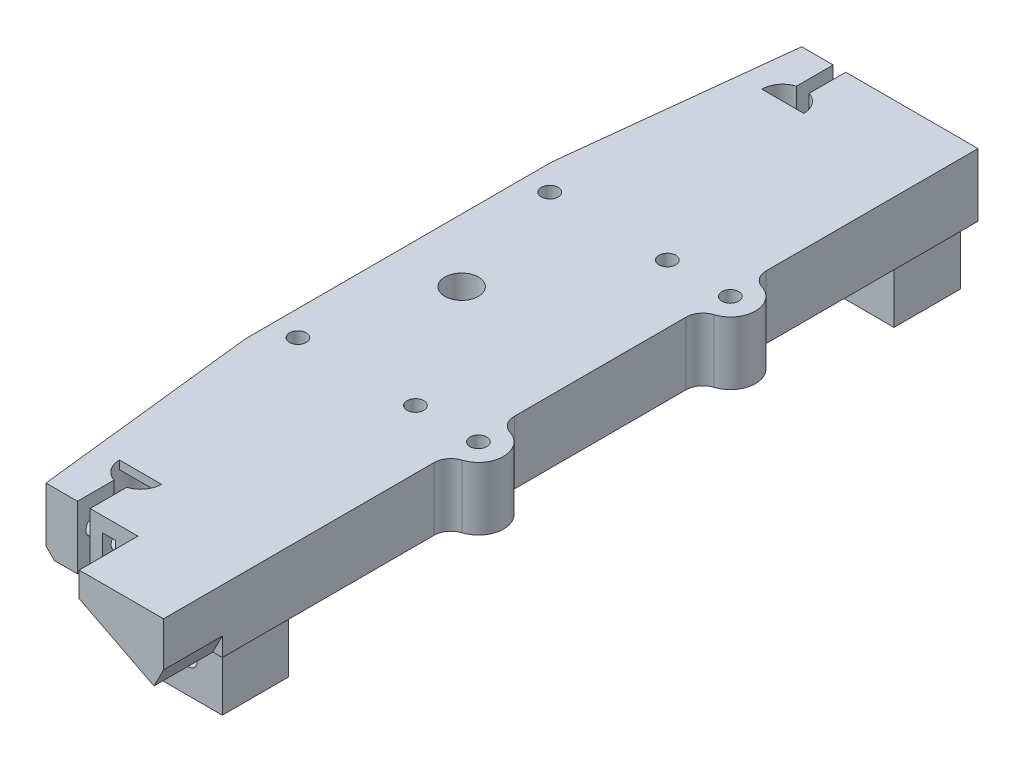
from build123d import *

# Parameters (mm, degrees)
SZKIC1_R                    = 4
SZKIC1_R_2                  = 2
DODANIE_WYCI_GNI_CIE1_DEPTH = 15
SZKIC2_W                    = 15.8
SZKIC2_H                    = 15.8
DODANIE_WYCI_GNI_CIE2_DEPTH = 14
DODANIE_WYCI_GNI_CIE3_START = -2
DODANIE_WYCI_GNI_CIE3_DEPTH = 2
DODANIE_WYCI_GNI_CIE4_DEPTH = 15
SZKIC5_R                    = 2
WYTNIJ_WYCI_GNI_CIE1_DEPTH  = 15
ZAOKR_GLENIE1_R             = 4
SFAZOWANIE1_SIZE            = 2
SZKIC6_R                    = 2
WYTNIJ_WYCI_GNI_CIE2_DEPTH  = 182.834155207
WYTNIJ_WYCI_GNI_CIE3_START  = -7
SZKIC8_R                    = 2
WYTNIJ_WYCI_GNI_CIE3_DEPTH  = 107.031560626
WYTNIJ_WYCI_GNI_CIE4_START  = 8
SZKIC9_R                    = 3.5
WYTNIJ_WYCI_GNI_CIE4_DEPTH  = 4
WYTNIJ_WYCI_GNI_CIE5_START  = -6
SZKIC10_R                   = 2
WYTNIJ_WYCI_GNI_CIE5_DEPTH  = 3
DODANIE_WYCI_GNI_CIE5_DEPTH = 14
SZKIC12_W                   = 10.2
SZKIC12_H                   = 10.2
WYTNIJ_WYCI_GNI_CIE6_DEPTH  = 14


with BuildPart() as part:
    # Szkic1 → Dodanie-wyciągnięcie1 (new body)
    with BuildSketch(Plane(origin=(0, 0, 0), x_dir=(1, 0, 0), z_dir=(0, 1, 0))):
        with BuildLine():
            Line((-14.5, 90), (-20.5, 36.5))
            Line((-20.5, 36.5), (-20.5, -36.5))
            Line((-20.5, -36.5), (-14.5, -90))
            Line((-14.5, -90), (-7, -90))
            Line((-7, -90), (-7, -81.269696007))
            ThreePointArc((-7, -81.269696007), (-5.5, -71.5), (-4, -81.269696007))
            Line((-4, -81.269696007), (-4, -90))
            Line((-4, -90), (27.5, -90))
            Line((27.5, -90), (27.5, 90))
            Line((27.5, 90), (-3.999999732, 90))
            Line((-3.999999732, 90), (-4, 81.269696007))
            ThreePointArc((-4, 81.269696007), (-5.5, 71.5), (-7, 81.269696007))
            Line((-7, 81.269696007), (-6.999999732, 90))
            Line((-6.999999732, 90), (-14.5, 90))
        make_face()
        with Locations((-5.5, 0)):
            Circle(SZKIC1_R, mode=Mode.SUBTRACT)
        with Locations((-14.5, 30)):
            Circle(SZKIC1_R_2, mode=Mode.SUBTRACT)
        with Locations((13.5, 30)):
            Circle(SZKIC1_R_2, mode=Mode.SUBTRACT)
        with Locations((-14.5, -30)):
            Circle(SZKIC1_R_2, mode=Mode.SUBTRACT)
        with Locations((13.5, -30)):
            Circle(SZKIC1_R_2, mode=Mode.SUBTRACT)
    extrude(amount=DODANIE_WYCI_GNI_CIE1_DEPTH)

    # Szkic2 → Dodanie-wyciągnięcie2 (add)
    with BuildSketch(Plane.XZ):
        with Locations((17.5, -80)):
            Rectangle(SZKIC2_W, SZKIC2_H)
    dodanie_wyci_gni_cie2 = extrude(amount=DODANIE_WYCI_GNI_CIE2_DEPTH)

    # Lustro1: Dodanie-wyciągnięcie2 across plane
    add(dodanie_wyci_gni_cie2.mirror(Plane.XY))

    # Szkic3 → Dodanie-wyciągnięcie3 (add)
    with BuildSketch(Plane(origin=(0, 15, 0), x_dir=(1, 0, 0), z_dir=(0, 1, 0)).offset(DODANIE_WYCI_GNI_CIE3_START)):
        with BuildLine():
            Line((-0.5, 76.5), (-10.5, 76.5))
            ThreePointArc((-10.5, 76.5), (-5.5, 71.5), (-0.5, 76.5))
        make_face()
        with BuildLine():
            ThreePointArc((-0.5, -76.5), (-5.5, -71.5), (-10.5, -76.5))
            Line((-10.5, -76.5), (-0.5, -76.5))
        make_face()
    extrude(amount=DODANIE_WYCI_GNI_CIE3_DEPTH)

    # Szkic4 → Dodanie-wyciągnięcie4 (add)
    with BuildSketch(Plane(origin=(0, 15, 0), x_dir=(1, 0, 0), z_dir=(0, 1, 0))):
        with BuildLine():
            ThreePointArc((27.5, -28.267949192), (30.5, -30), (27.5, -31.732050808))
            Line((27.5, -31.732050808), (27.5, -35.916079783))
            ThreePointArc((27.5, -35.916079783), (34.5, -30), (27.5, -24.083920217))
            Line((27.5, -24.083920217), (27.5, -28.267949192))
        make_face()
        with BuildLine():
            Line((27.5, 28.267949192), (27.5, 24.083920217))
            ThreePointArc((27.5, 24.083920217), (34.5, 30), (27.5, 35.916079783))
            Line((27.5, 35.916079783), (27.5, 31.732050808))
            ThreePointArc((27.5, 31.732050808), (30.5, 30), (27.5, 28.267949192))
        make_face()
    extrude(amount=-DODANIE_WYCI_GNI_CIE4_DEPTH)

    # Szkic5 → Wytnij-wyciągnięcie1 (cut)
    with BuildSketch(Plane(origin=(0, 15, 0), x_dir=(1, 0, 0), z_dir=(0, 1, 0))):
        with Locations((28.5, 30)):
            Circle(SZKIC5_R)
        with Locations((28.5, -30)):
            Circle(SZKIC5_R)
    extrude(amount=-WYTNIJ_WYCI_GNI_CIE1_DEPTH, mode=Mode.SUBTRACT)

    # Zaokrąglenie1
    zaokr_glenie1_edges = [part.edges().sort_by_distance(p)[0] for p in [
        (27.5, 7.5, -35.916079783),
        (27.5, 7.5, -24.083920217),
        (27.5, 7.5, 24.083920217),
        (27.5, 7.5, 35.916079783),
    ]]
    fillet(zaokr_glenie1_edges, radius=ZAOKR_GLENIE1_R)

    # Sfazowanie1
    sfazowanie1_edges = [part.edges().sort_by_distance(p)[0] for p in [
        (-17.5, 0, -63.25),
        (-17.5, 0, 63.25),
        (-20.5, 0, 0),
    ]]
    chamfer(sfazowanie1_edges, length=SFAZOWANIE1_SIZE)

    # Szkic6 → Wytnij-wyciągnięcie2 (cut, through all)
    with BuildSketch(Plane.XY.offset(87.9)):
        with Locations((17.4, -6)):
            Circle(SZKIC6_R)
    extrude(amount=-WYTNIJ_WYCI_GNI_CIE2_DEPTH, mode=Mode.SUBTRACT)

    # Szkic8 → Wytnij-wyciągnięcie3 (cut)
    with BuildSketch(Plane.ZY.offset(4).offset(WYTNIJ_WYCI_GNI_CIE3_START)):
        with Locations((86, 8)):
            Circle(SZKIC8_R)
    wytnij_wyci_gni_cie3 = extrude(amount=WYTNIJ_WYCI_GNI_CIE3_DEPTH, mode=Mode.SUBTRACT)

    # Szkic9 → Wytnij-wyciągnięcie4 (cut)
    with BuildSketch(Plane.ZY.offset(4).offset(WYTNIJ_WYCI_GNI_CIE4_START)):
        with Locations((86, 8)):
            Circle(SZKIC9_R)
    wytnij_wyci_gni_cie4 = extrude(amount=WYTNIJ_WYCI_GNI_CIE4_DEPTH, mode=Mode.SUBTRACT)

    # Szkic10 → Wytnij-wyciągnięcie5 (cut)
    with BuildSketch(Plane.ZY.offset(4).offset(WYTNIJ_WYCI_GNI_CIE5_START)):
        Polygon((83, 6.267949192), (86, 4.535898385), (90, 4.535898385), (90, 11.464101615), (86, 11.464101615), (83, 9.732050808), align=None)
        with Locations((86, 8)):
            Circle(SZKIC10_R, mode=Mode.SUBTRACT)
    wytnij_wyci_gni_cie5 = extrude(amount=WYTNIJ_WYCI_GNI_CIE5_DEPTH, mode=Mode.SUBTRACT)

    # Lustro2: Wytnij-wyciągnięcie3, Wytnij-wyciągnięcie4, Wytnij-wyciągnięcie5 across plane
    add(wytnij_wyci_gni_cie3.mirror(Plane.XY), mode=Mode.SUBTRACT)
    add(wytnij_wyci_gni_cie4.mirror(Plane.XY), mode=Mode.SUBTRACT)
    add(wytnij_wyci_gni_cie5.mirror(Plane.XY), mode=Mode.SUBTRACT)

    # Szkic11 → Dodanie-wyciągnięcie5 (add)
    with BuildSketch(Plane.XY.offset(90)):
        Polygon((7.409917018, 9.079809995), (25.230047501, 0), (27.5, 4.455032621), (27.5, 15), (7.409917018, 15), align=None)
    extrude(amount=DODANIE_WYCI_GNI_CIE5_DEPTH)

    # Szkic12 → Wytnij-wyciągnięcie6 (cut)
    with BuildSketch(Plane(origin=(7.470051331, 14.66080122, 0), x_dir=(0.8910065241883673, -0.453990499739548, 0), z_dir=(0.453990499739548, 0.8910065241883673, 0))):
        with Locations((11.880136929, -96.1)):
            Rectangle(SZKIC12_W, SZKIC12_H)
    extrude(amount=-WYTNIJ_WYCI_GNI_CIE6_DEPTH, mode=Mode.SUBTRACT)


solid = part.part
